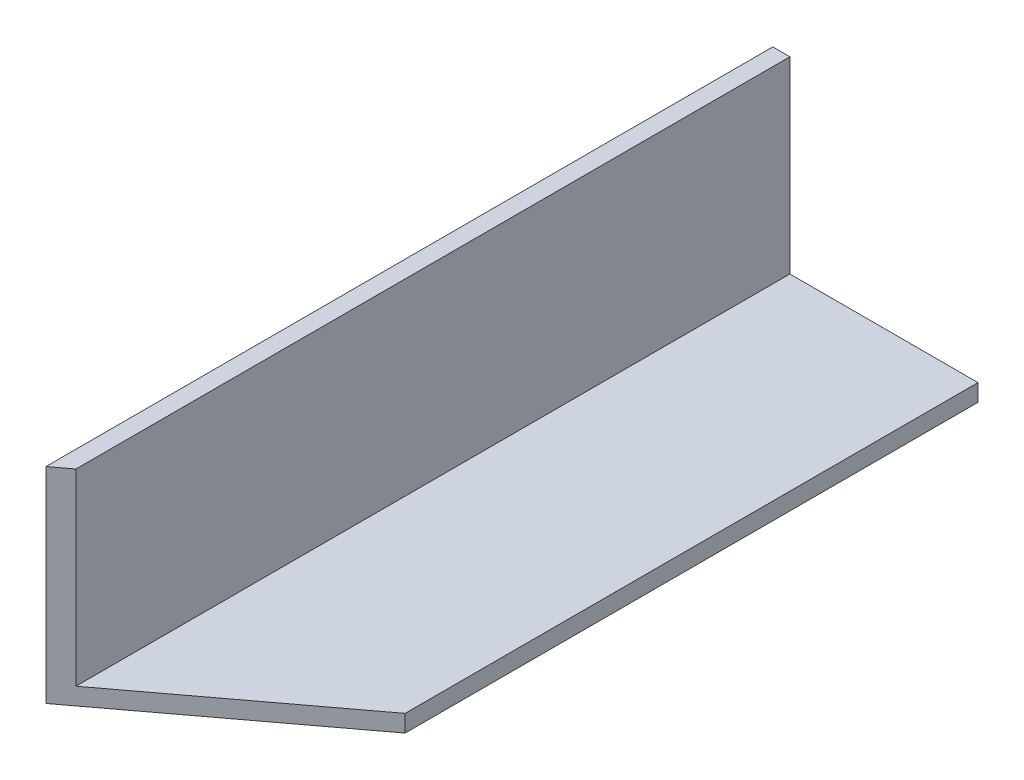
from build123d import *

# Parameters (mm, degrees)
SKETCH1_W           = 38.1
SKETCH1_H           = 38.1
BOSS_EXTRUDE1_DEPTH = 134.93774257
SKETCH2_W           = 34.925
SKETCH2_H           = 34.925
CUT_EXTRUDE1_DEPTH  = 134.93774257
CUT_EXTRUDE2_DEPTH  = 38.1


with BuildPart() as part:
    # Sketch1 → Boss-Extrude1 (new body)
    with BuildSketch(Plane.XY):
        with Locations((19.05, 19.05)):
            Rectangle(SKETCH1_W, SKETCH1_H)
    extrude(amount=BOSS_EXTRUDE1_DEPTH)

    # Sketch2 → Cut-Extrude1 (cut)
    with BuildSketch(Plane.XY.offset(134.93774257)):
        with Locations((20.6375, 20.6375)):
            Rectangle(SKETCH2_W, SKETCH2_H)
    extrude(amount=-CUT_EXTRUDE1_DEPTH, mode=Mode.SUBTRACT)

    # Sketch4 → Cut-Extrude2 (cut)
    with BuildSketch(Plane(origin=(0, 0, 0), x_dir=(-1, 0, 0), z_dir=(0, -1, 0))):
        Polygon((0, -134.93774257), (-38.1, -106.362636222), (-38.1, -134.93774257), align=None)
    extrude(amount=-CUT_EXTRUDE2_DEPTH, mode=Mode.SUBTRACT)


solid = part.part
